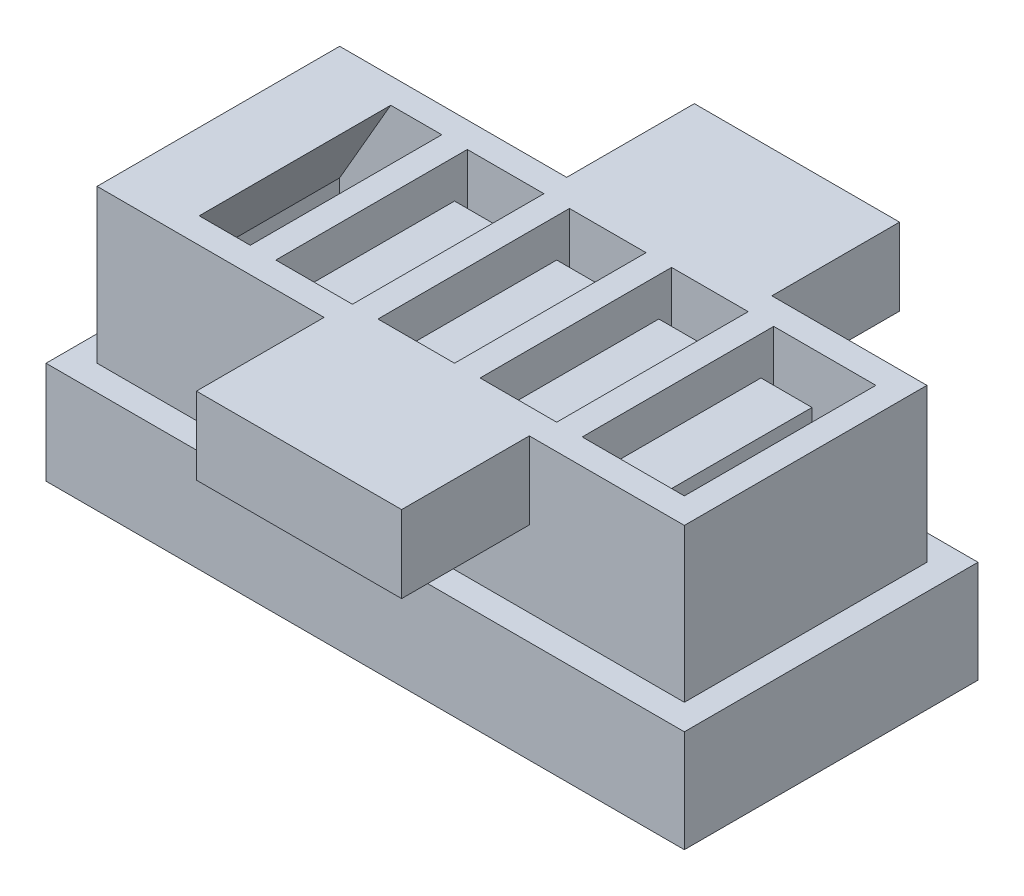
from build123d import *

# Parameters (mm, degrees)
BOSS_EXTRUDE1_DEPTH      = 7.5
BOSS_EXTRUDE1_DEPTH_BACK = 7.5
CUT_EXTRUDE1_DEPTH       = 5.5
CUT_EXTRUDE1_DEPTH_BACK  = 5.5
SKETCH2_W                = 4
SKETCH2_H                = 13
SKETCH3_W                = 36
SKETCH3_H                = 2
CUT_EXTRUDE2_DEPTH       = 2
BOSS_EXTRUDE2_DEPTH      = 15
BOSS_EXTRUDE2_DEPTH_BACK = 5
SKETCH4_W                = 46
SKETCH4_H                = 19
SPLIT1_START             = -5.5
SPLIT1_DEPTH             = 11
SPLIT1_START_2           = -9.5
SPLIT1_2_OUTLINE_W       = 46
SPLIT1_2_OUTLINE_H       = 5
SPLIT1_2_DEPTH           = 19
SPLIT1_START_3           = -1
SPLIT1_3_OUTLINE_W       = 4
SPLIT1_3_OUTLINE_H       = 2
SPLIT1_3_DEPTH           = 2
SPLIT1_START_4           = -5
SPLIT1_4_OUTLINE_W       = 46
SPLIT1_4_OUTLINE_H       = 19
SPLIT1_4_DEPTH           = 5
SPLIT1_5_OUTLINE_W       = 4
SPLIT1_5_OUTLINE_H       = 11
SPLIT1_5_DEPTH           = 13
SPLIT1_6_OUTLINE_W       = 4
SPLIT1_6_OUTLINE_H       = 2
SPLIT1_6_DEPTH           = 2
SKETCH5_W                = 16.073439162
SKETCH5_H                = 6.039622656
BOSS_EXTRUDE3_DEPTH      = 10
SKETCH6_W                = 50
SKETCH6_H                = 23
SKETCH6_W_2              = 46
SKETCH6_H_2              = 19
BOSS_EXTRUDE4_DEPTH      = 8


# Read off the part's stored shape, not the designer's step: Split1
with BuildPart() as part:
    # Sketch1 → Boss-Extrude1 (new, two sides: drawn at the far end of the back side and taken through both)
    with BuildSketch(Plane.XY.offset(-BOSS_EXTRUDE1_DEPTH_BACK)):
        Polygon((-21, 0), (21, 0), (21, 15), (13, 15), (13, 4), (11, 4), (11, 15), (5, 15), (5, 4), (3, 4), (3, 15), (-3, 15), (-3, 4), (-5, 4), (-5, 15), (-11, 15), (-11, 4), (-13, 4), (-13, 15), (-17, 15), (-21, 8.07179677), align=None)
    extrude(amount=BOSS_EXTRUDE1_DEPTH + BOSS_EXTRUDE1_DEPTH_BACK)

    # Sketch2 → Cut-Extrude1 (cut, two sides: drawn at the far end of the back side and taken through both)
    with BuildSketch(Plane.XY.offset(-CUT_EXTRUDE1_DEPTH_BACK)):
        Polygon((-14, 13), (-14, 0), (-18, 0), (-18, 7.267949192), (-14.690598923, 13), align=None)
        with Locations((-8, 6.5)):
            Rectangle(SKETCH2_W, SKETCH2_H)
        with Locations((0, 6.5)):
            Rectangle(SKETCH2_W, SKETCH2_H)
        with Locations((8, 6.5)):
            Rectangle(SKETCH2_W, SKETCH2_H)
        with Locations((16, 6.5)):
            Rectangle(SKETCH2_W, SKETCH2_H)
    extrude(amount=CUT_EXTRUDE1_DEPTH + CUT_EXTRUDE1_DEPTH_BACK, mode=Mode.SUBTRACT)

    # Sketch3 → Cut-Extrude2 (cut)
    with BuildSketch(Plane(origin=(0, 0, 0), x_dir=(-1, 0, 0), z_dir=(0, -1, 0))):
        Rectangle(SKETCH3_W, SKETCH3_H)
    extrude(amount=-CUT_EXTRUDE2_DEPTH, mode=Mode.SUBTRACT)


with BuildPart() as body_2:
    # Sketch4 → Boss-Extrude2 (new, two sides: drawn at the far end of the back side and taken through both)
    with BuildSketch(Plane(origin=(0, 0, 0), x_dir=(1, 0, 0), z_dir=(0, 1, 0)).offset(-BOSS_EXTRUDE2_DEPTH_BACK)):
        Rectangle(SKETCH4_W, SKETCH4_H)
    extrude(amount=BOSS_EXTRUDE2_DEPTH + BOSS_EXTRUDE2_DEPTH_BACK)

    # Combine1: cut part
    add(part.part, mode=Mode.SUBTRACT)

    # Split1 4 outline → Split1 4 (cut)
    with BuildSketch(Plane(origin=(0, 0, 0), x_dir=(1, 0, 0), z_dir=(0, 1, 0)).offset(SPLIT1_START_4)):
        Rectangle(SPLIT1_4_OUTLINE_W, SPLIT1_4_OUTLINE_H)
    extrude(amount=SPLIT1_4_DEPTH, mode=Mode.SUBTRACT)

    # Split1 5 outline → Split1 5 (cut)
    with BuildSketch(Plane(origin=(0, 0, 0), x_dir=(1, 0, 0), z_dir=(0, 1, 0))):
        with Locations((-8, 0)):
            Rectangle(SPLIT1_5_OUTLINE_W, SPLIT1_5_OUTLINE_H)
        Rectangle(SPLIT1_5_OUTLINE_W, SPLIT1_5_OUTLINE_H)
        with Locations((-16, 0)):
            Rectangle(SPLIT1_5_OUTLINE_W, SPLIT1_5_OUTLINE_H)
        with Locations((8, 0)):
            Rectangle(SPLIT1_5_OUTLINE_W, SPLIT1_5_OUTLINE_H)
        with Locations((16, 0)):
            Rectangle(SPLIT1_5_OUTLINE_W, SPLIT1_5_OUTLINE_H)
    extrude(amount=SPLIT1_5_DEPTH, mode=Mode.SUBTRACT)

    # Split1 6 outline → Split1 6 (cut)
    with BuildSketch(Plane(origin=(0, 0, 0), x_dir=(1, 0, 0), z_dir=(0, 1, 0))):
        with Locations((-4, 0)):
            Rectangle(SPLIT1_6_OUTLINE_W, SPLIT1_6_OUTLINE_H)
        with Locations((-12, 0)):
            Rectangle(SPLIT1_6_OUTLINE_W, SPLIT1_6_OUTLINE_H)
        with Locations((4, 0)):
            Rectangle(SPLIT1_6_OUTLINE_W, SPLIT1_6_OUTLINE_H)
        with Locations((12, 0)):
            Rectangle(SPLIT1_6_OUTLINE_W, SPLIT1_6_OUTLINE_H)
    extrude(amount=SPLIT1_6_DEPTH, mode=Mode.SUBTRACT)

    # Sketch5 → Boss-Extrude3 (add)
    with BuildSketch(Plane.XY.offset(9.5)):
        with Locations((2.818305229, 11.980188672)):
            Rectangle(SKETCH5_W, SKETCH5_H)
    boss_extrude3 = extrude(amount=BOSS_EXTRUDE3_DEPTH)

    # Mirror1: Boss-Extrude3 across plane
    add(boss_extrude3.mirror(Plane.XY))


with BuildPart() as body_2_2:
    # Split1 outline → Split1 (new body)
    with BuildSketch(Plane.XY.offset(SPLIT1_START)):
        Polygon((18, 0), (18, 13), (14, 13), (14, 0), (10, 0), (10, 13), (6, 13), (6, 0), (2, 0), (2, 13), (-2, 13), (-2, 0), (-6, 0), (-6, 13), (-10, 13), (-10, 0), (-14, 0), (-14, 13), (-14.690598923, 13), (-18, 7.267949192), (-18, 0), (-23, 0), (-23, -5), (23, -5), (23, 0), align=None)
    extrude(amount=SPLIT1_DEPTH)

    # Split1 2 outline → Split1 2 (add)
    with BuildSketch(Plane.XY.offset(SPLIT1_START_2)):
        with Locations((0, -2.5)):
            Rectangle(SPLIT1_2_OUTLINE_W, SPLIT1_2_OUTLINE_H)
    extrude(amount=SPLIT1_2_DEPTH)

    # Split1 3 outline → Split1 3 (add)
    with BuildSketch(Plane.XY.offset(SPLIT1_START_3)):
        with Locations((12, 1)):
            Rectangle(SPLIT1_3_OUTLINE_W, SPLIT1_3_OUTLINE_H)
        with Locations((4, 1)):
            Rectangle(SPLIT1_3_OUTLINE_W, SPLIT1_3_OUTLINE_H)
        with Locations((-4, 1)):
            Rectangle(SPLIT1_3_OUTLINE_W, SPLIT1_3_OUTLINE_H)
        with Locations((-12, 1)):
            Rectangle(SPLIT1_3_OUTLINE_W, SPLIT1_3_OUTLINE_H)
    extrude(amount=SPLIT1_3_DEPTH)

    # Sketch6 → Boss-Extrude4 (add)
    with BuildSketch(Plane.XZ.offset(5)):
        Rectangle(SKETCH6_W, SKETCH6_H)
        Rectangle(SKETCH6_W_2, SKETCH6_H_2, mode=Mode.SUBTRACT)
    extrude(amount=-BOSS_EXTRUDE4_DEPTH)


solid = Compound([body_2.part, body_2_2.part])
